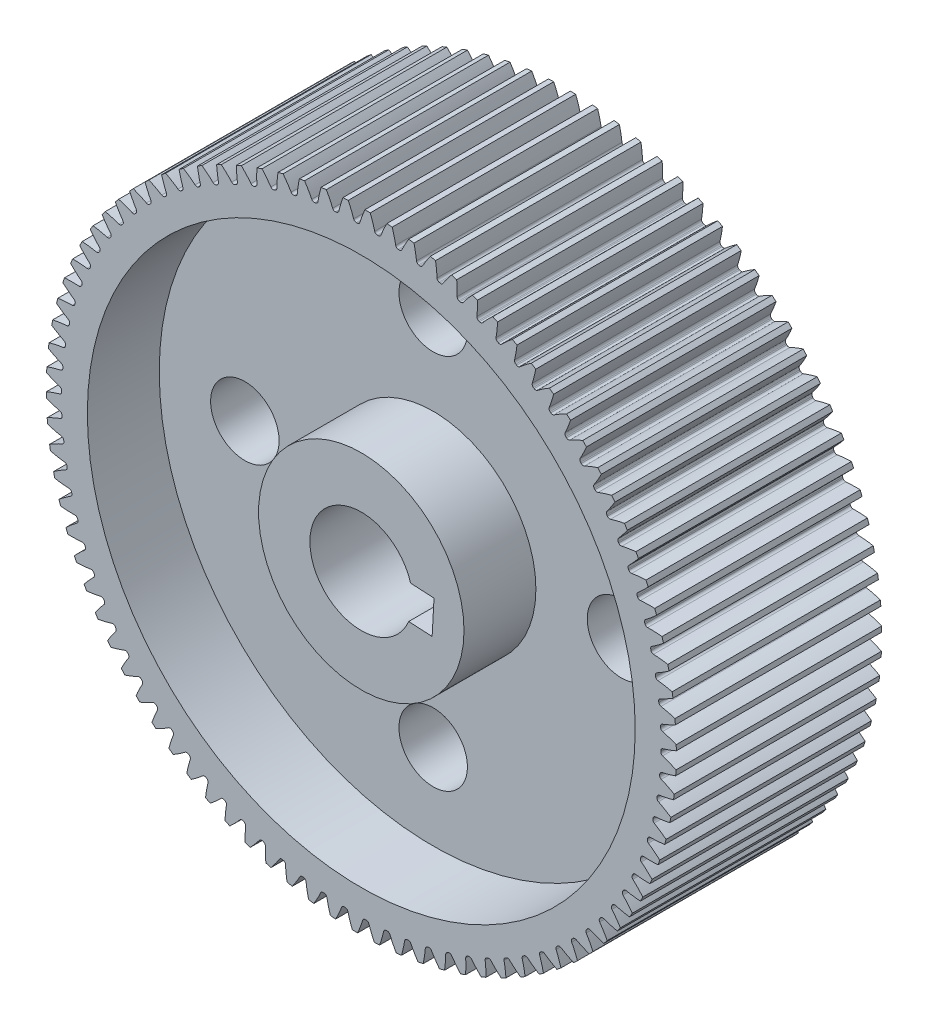
from build123d import *

# Parameters (mm, degrees)
SKETCH3_R          = 46
GEARBODY_DEPTH     = 30
TOOTHCUT_DEPTH     = 72.637978754
CIRPATTERN1_COUNT  = 90
BOREDIA_R          = 7.5
BORE_DEPTH         = 12700
KWY1_DEPTH         = 6350
SKETCH4_R          = 40
SKETCH4_R_2        = 15
CUT_EXTRUDE1_DEPTH = 10.5
CUT_EXTRUDE2_START = -10.5
SKETCH6_R          = 40
SKETCH6_R_2        = 15
CUT_EXTRUDE2_DEPTH = 10.5
SKETCH7_R          = 5
CUT_EXTRUDE3_DEPTH = 10.5


with BuildPart() as part:
    # Sketch3 → gearBody (new body)
    with BuildSketch(Plane.XY):
        Circle(SKETCH3_R)
    extrude(amount=GEARBODY_DEPTH)

    # Sketch2 → toothCut (cut, through all)
    with BuildSketch(Plane.XY):
        with BuildLine():
            ThreePointArc((43.738849262, -0.951612234), (43.740441401, -0.875378024), (43.741900668, -0.799141155))
            ThreePointArc((43.741900668, -0.799141155), (43.823127278, -0.564939845), (44.026901576, -0.423787262))
            ThreePointArc((44.026901576, -0.423787262), (49.294760818, 2.190922253), (53.384897853, 6.416774342))
            ThreePointArc((53.384897853, 6.416774342), (53.758393028, -1.075867421), (53.085416311, -8.547566129))
            ThreePointArc((53.085416311, -8.547566129), (49.167630682, -4.161451378), (44.008604054, -1.338068461))
            ThreePointArc((44.008604054, -1.338068461), (43.810640438, -1.188875891), (43.738849262, -0.951612234))
        make_face()
    toothcut = extrude(amount=TOOTHCUT_DEPTH, mode=Mode.SUBTRACT)

    # CirPattern1: toothCut ×90 about axis
    cirpattern1_axis = Axis((0, 0, 30), (0, 0, -1))
    for i in range(1, CIRPATTERN1_COUNT):
        add(toothcut.rotate(cirpattern1_axis, i * 360 / CIRPATTERN1_COUNT), mode=Mode.SUBTRACT)

    # boreDia → bore (cut, symmetric)
    with BuildSketch(Plane.XY):
        Circle(BOREDIA_R)
    extrude(amount=BORE_DEPTH, both=True, mode=Mode.SUBTRACT)

    # kwy1sketch → kwy1 (cut, symmetric)
    with BuildSketch(Plane.XY):
        Polygon((10.621393986, 1.919893175), (10.346947349, -3.072569048), (4.106369571, -2.729510752), (0, 0), (4.380816207, 2.26295147), align=None)
    extrude(amount=KWY1_DEPTH, both=True, mode=Mode.SUBTRACT)

    # Sketch4 → Cut-Extrude1 (cut)
    with BuildSketch(Plane(origin=(0, 0, 0), x_dir=(-1, 0, 0), z_dir=(0, 0, -1))):
        Circle(SKETCH4_R)
        Circle(SKETCH4_R_2, mode=Mode.SUBTRACT)
    extrude(amount=-CUT_EXTRUDE1_DEPTH, mode=Mode.SUBTRACT)

    # Sketch6 → Cut-Extrude2 (cut)
    with BuildSketch(Plane.XY.offset(30).offset(CUT_EXTRUDE2_START)):
        Circle(SKETCH6_R)
        Circle(SKETCH6_R_2, mode=Mode.SUBTRACT)
    extrude(amount=CUT_EXTRUDE2_DEPTH, mode=Mode.SUBTRACT)

    # Sketch7 → Cut-Extrude3 (cut)
    with BuildSketch(Plane.XY.offset(19.5)):
        with Locations((27.5, 0)):
            Circle(SKETCH7_R)
        with Locations((0, 27.5)):
            Circle(SKETCH7_R)
        with Locations((-27.5, 0)):
            Circle(SKETCH7_R)
        with Locations((0, -27.5)):
            Circle(SKETCH7_R)
    extrude(amount=-CUT_EXTRUDE3_DEPTH, mode=Mode.SUBTRACT)


solid = part.part
